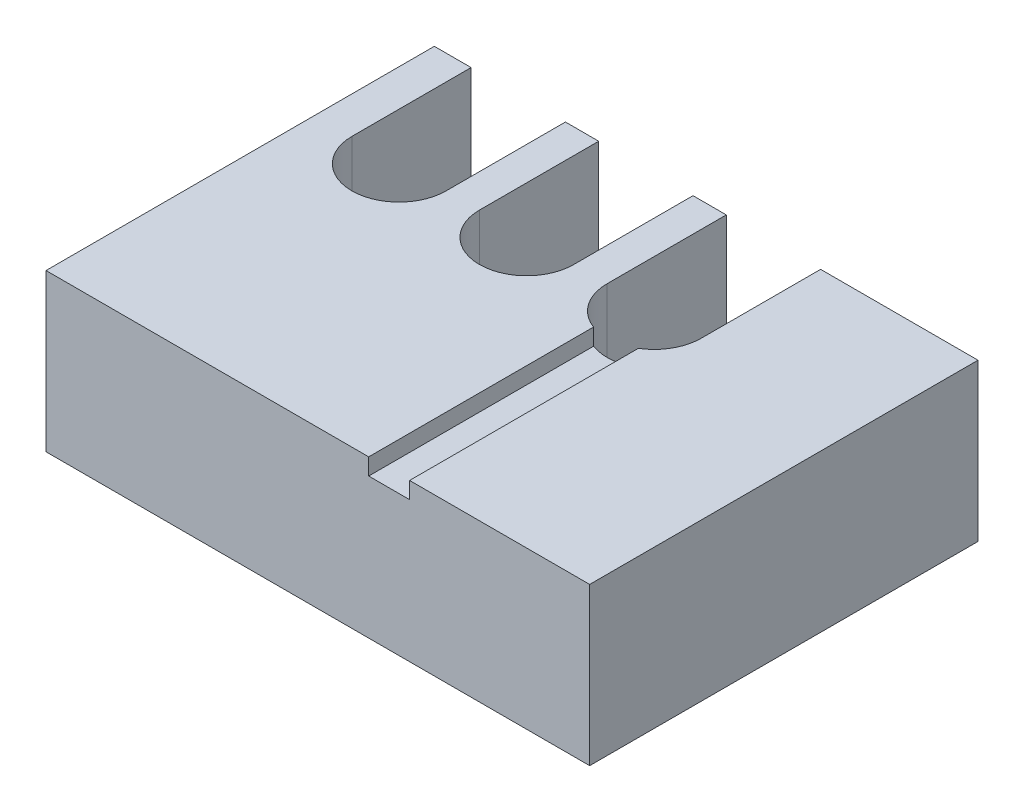
from build123d import *

# Parameters (mm, degrees)
SKIZZE1_W                       = 95
SKIZZE1_H                       = 70
AUFSATZ_LINEAR_AUSTRAGEN1_DEPTH = 28.3
SCHNITT_LINEAR_AUSTRAGEN1_REACH = 123.35
SKIZZE2_W                       = 7.37
SKIZZE2_H                       = 3
SCHNITT_LINEAR_AUSTRAGEN2_DEPTH = 30
VERRUNDUNG1_R                   = 8.5
AUFSATZ_LINEAR_AUSTRAGEN3_DEPTH = 3
VERRUNDUNG2_R                   = 8


with BuildPart() as part:
    # Skizze1 → Aufsatz-Linear austragen1 (new body)
    with BuildSketch(Plane(origin=(0, 0, 0), x_dir=(1, 0, 0), z_dir=(0, 1, 0))):
        with Locations((47.5, 35)):
            Rectangle(SKIZZE1_W, SKIZZE1_H)
    extrude(amount=AUFSATZ_LINEAR_AUSTRAGEN1_DEPTH)

    # Skizze2 → Schnitt-Linear austragen1 (cut, up to next)
    with BuildSketch(Plane.XY, mode=Mode.PRIVATE) as schnitt_linear_austragen1_sk1:
        with Locations((58.855, 26.8)):
            Rectangle(SKIZZE2_W, SKIZZE2_H)
    schnitt_linear_austragen1_tool1 = extrude(schnitt_linear_austragen1_sk1.sketch, amount=-SCHNITT_LINEAR_AUSTRAGEN1_REACH, mode=Mode.PRIVATE) & part.part
    add(schnitt_linear_austragen1_tool1.solids().sort_by_distance((58.855, 26.8, 0))[0], mode=Mode.SUBTRACT)

    # Skizze4 → Schnitt-Linear austragen2 (cut)
    with BuildSketch(Plane(origin=(0, 0, -70), x_dir=(-1, 0, 0), z_dir=(0, 0, -1))):
        Polygon((-3.63, 0), (-71.13, 0), (-71.13, 3), (-66.63, 3), (-66.63, 28.3), (-49.63, 28.3), (-49.63, 3), (-43.63, 3), (-43.63, 28.3), (-26.63, 28.3), (-26.63, 3), (-20.63, 3), (-20.63, 28.3), (-3.63, 28.3), (-3.63, 3), (0, 3), (0, 0), align=None)
    extrude(amount=-SCHNITT_LINEAR_AUSTRAGEN2_DEPTH, mode=Mode.SUBTRACT)

    # Verrundung1
    verrundung1_edges = [part.edges().sort_by_distance(p)[0] for p in [
        (3.63, 15.65, -40),
        (20.63, 15.65, -40),
        (26.63, 15.65, -40),
        (43.63, 15.65, -40),
        (49.63, 15.65, -40),
        (66.63, 15.65, -40),
    ]]
    fillet(verrundung1_edges, radius=VERRUNDUNG1_R - 0.0001)  # a hair under: the kernel refuses the full size

    # Skizze5 → Aufsatz-Linear austragen3 (add)
    with BuildSketch(Plane.ZY):
        Polygon((0, 0), (-40, 0), (-40, 3), (-70, 3), (-70, 28.3), (0, 28.3), align=None)
    extrude(amount=AUFSATZ_LINEAR_AUSTRAGEN3_DEPTH)

    # Verrundung2
    verrundung2_edges = [part.edges().sort_by_distance(p)[0] for p in [
        (71.13, 1.5, -40),
    ]]
    fillet(verrundung2_edges, radius=VERRUNDUNG2_R)


solid = part.part
